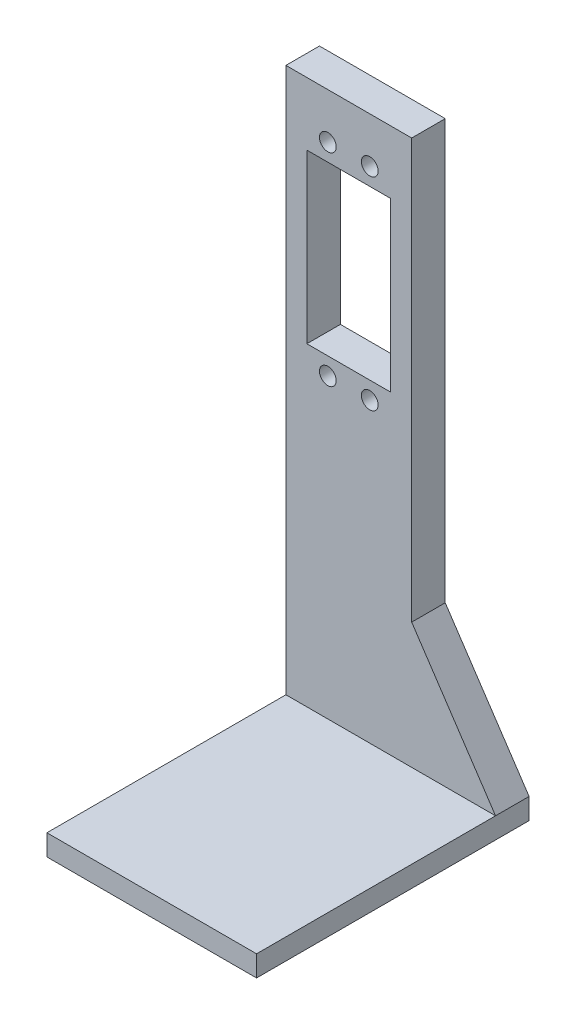
from build123d import *

# Parameters (mm, degrees)
SKETCH1_W           = 50
SKETCH1_H           = 65
BOSS_EXTRUDE1_DEPTH = 5
BOSS_EXTRUDE2_DEPTH = 8
SKETCH3_R           = 2
SKETCH3_W           = 20
SKETCH3_H           = 40
CUT_EXTRUDE1_DEPTH  = 155.83539647


with BuildPart() as part:
    # Sketch1 → Boss-Extrude1 (new body)
    with BuildSketch(Plane(origin=(0, 0, 0), x_dir=(1, 0, 0), z_dir=(0, 1, 0))):
        with Locations((-25, -32.5)):
            Rectangle(SKETCH1_W, SKETCH1_H)
    extrude(amount=BOSS_EXTRUDE1_DEPTH)

    # Sketch2 → Boss-Extrude2 (add)
    with BuildSketch(Plane.XY):
        Polygon((0, 5), (-20, 35), (-20, 135), (-50, 135), (-50, 5), align=None)
    extrude(amount=BOSS_EXTRUDE2_DEPTH)

    # Sketch3 → Cut-Extrude1 (cut, through all)
    with BuildSketch(Plane.XY.offset(8)):
        with Locations((-40, 124.15)):
            Circle(SKETCH3_R)
        with Locations((-30, 124.15)):
            Circle(SKETCH3_R)
        with Locations((-40, 75.85)):
            Circle(SKETCH3_R)
        with Locations((-30, 75.85)):
            Circle(SKETCH3_R)
        with Locations((-35, 100)):
            Rectangle(SKETCH3_W, SKETCH3_H)
    extrude(amount=-CUT_EXTRUDE1_DEPTH, mode=Mode.SUBTRACT)


solid = part.part
